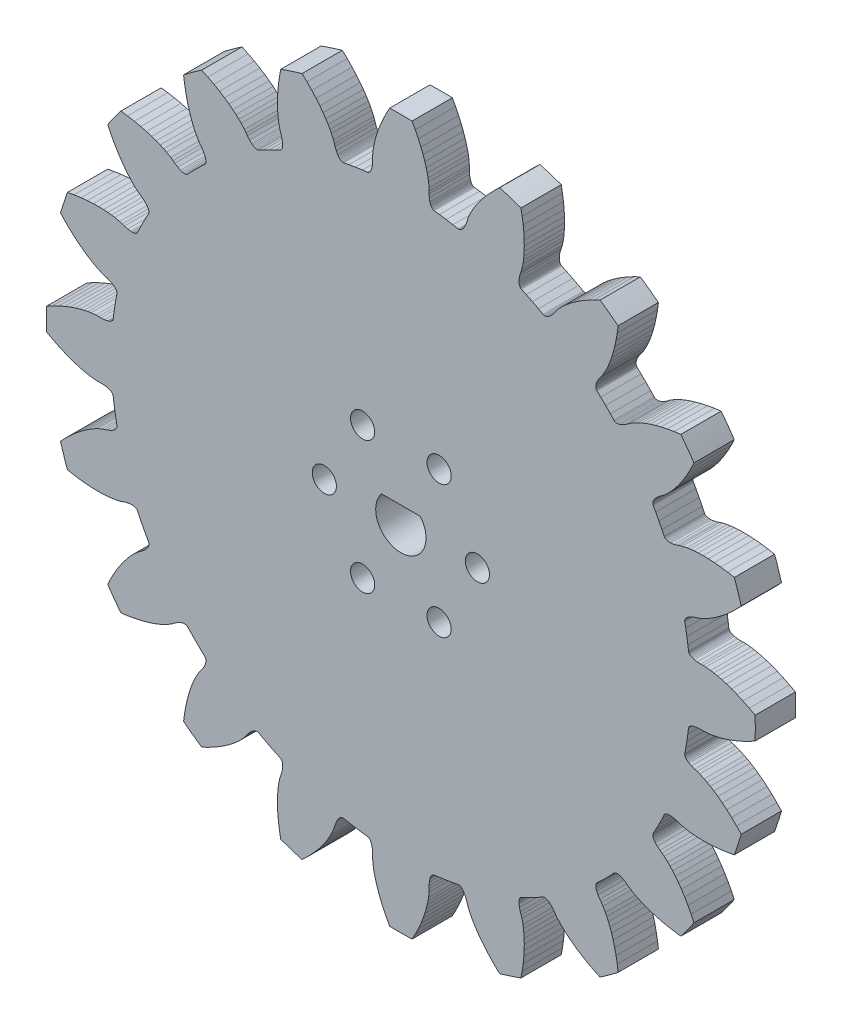
from build123d import *

# Parameters (mm, degrees)
MODEL_R             = 0.5
BOSS_EXTRUDE1_DEPTH = 5
CUT_EXTRUDE1_DEPTH  = 63.425869445
SKETCH6_R           = 1.5
CUT_EXTRUDE3_DEPTH  = 10
CIRPATTERN1_COUNT   = 3
SKETCH5_R           = 2.05
CUT_EXTRUDE2_DEPTH  = 10


with BuildPart() as part:
    # Model → Boss-Extrude1 (new body)
    with BuildSketch(Plane.XY):
        with BuildLine():
            Line((41.0580513, 11.0594647), (41.6786239, 11.6621942))
            Line((41.6786239, 11.6621942), (42.254799591, 12.268924064))
            ThreePointArc((42.254799591, 12.268924064), (41.846428175, 13.596728691), (41.396343585, 14.910979886))
            Line((41.396343585, 14.910979886), (40.5735808, 15.0631672))
            Line((40.5735808, 15.0631672), (39.7172515, 15.1860222))
            Line((39.7172515, 15.1860222), (38.9209581, 15.2664261))
            Line((38.9209581, 15.2664261), (38.188074, 15.3095207))
            Line((38.188074, 15.3095207), (37.5212498, 15.3207867))
            Line((37.5212498, 15.3207867), (36.9192091, 15.3057692))
            Line((36.9192091, 15.3057692), (36.385219, 15.2700607))
            Line((36.385219, 15.2700607), (35.9182805, 15.2191681))
            Line((35.9182805, 15.2191681), (35.519022, 15.1586865))
            Line((35.519022, 15.1586865), (34.9229912, 15.031255))
            Line((34.9229912, 15.031255), (34.5912709, 14.9315723))
            Line((34.5912709, 14.9315723), (34.3145829, 14.8346777))
            Line((34.3145829, 14.8346777), (33.8996768, 14.7245961))
            Line((33.8996768, 14.7245961), (33.5375203, 14.6729516))
            Line((33.5375203, 14.6729516), (33.3775076, 14.6675821))
            Line((33.3775076, 14.6675821), (33.232174, 14.6750343))
            Line((33.232174, 14.6750343), (33.1019936, 14.6947079))
            Line((33.1019936, 14.6947079), (32.9874095, 14.7259534))
            Line((32.9874095, 14.7259534), (32.8888203, 14.7681208))
            Line((32.8888203, 14.7681208), (32.8066469, 14.8205604))
            Line((32.8066469, 14.8205604), (32.74127, 14.8825908))
            Line((32.74127, 14.8825908), (32.6837041, 14.9725741))
            Line((32.6837041, 14.9725741), (32.4071065, 15.5624769))
            Line((32.4071065, 15.5624769), (32.0316845, 16.3209585))
            Line((32.0316845, 16.3209585), (31.6387276, 17.0705055))
            Line((31.6387276, 17.0705055), (31.3240661, 17.6410139))
            Line((31.3240661, 17.6410139), (31.2851045, 17.7404764))
            Line((31.2851045, 17.7404764), (31.2733484, 17.829828))
            Line((31.2733484, 17.829828), (31.2792242, 17.927131))
            Line((31.2792242, 17.927131), (31.3030593, 18.0316767))
            Line((31.3030593, 18.0316767), (31.345132, 18.1427428))
            Line((31.345132, 18.1427428), (31.4057339, 18.2596248))
            Line((31.4057339, 18.2596248), (31.48513, 18.3815824))
            Line((31.48513, 18.3815824), (31.583527, 18.5078793))
            Line((31.583527, 18.5078793), (31.8381786, 18.7705142))
            Line((31.8381786, 18.7705142), (32.1711122, 19.0414759))
            Line((32.1711122, 19.0414759), (32.4121346, 19.208368))
            Line((32.4121346, 19.208368), (32.6877599, 19.4181434))
            Line((32.6877599, 19.4181434), (33.1411923, 19.8254401))
            Line((33.1411923, 19.8254401), (33.4248012, 20.1128967))
            Line((33.4248012, 20.1128967), (33.7404338, 20.460744))
            Line((33.7404338, 20.460744), (34.083194, 20.8717622))
            Line((34.083194, 20.8717622), (34.4492141, 21.3499962))
            Line((34.4492141, 21.3499962), (34.8320491, 21.8960904))
            Line((34.8320491, 21.8960904), (35.2279633, 22.5143365))
            Line((35.2279633, 22.5143365), (35.6309647, 23.2058115))
            Line((35.6309647, 23.2058115), (36.0349107, 23.9708089))
            Line((36.0349107, 23.9708089), (36.395396459, 24.725891411))
            ThreePointArc((36.395396459, 24.725891411), (35.596697995, 25.862514918), (34.762516187, 26.973358268))
            Line((34.762516187, 26.973358268), (33.9329938, 26.8638493))
            Line((33.9329938, 26.8638493), (33.0806119, 26.716071))
            Line((33.0806119, 26.716071), (32.2984457, 26.5464715))
            Line((32.2984457, 26.5464715), (31.5881145, 26.3609832))
            Line((31.5881145, 26.3609832), (30.9504457, 26.1656379))
            Line((30.9504457, 26.1656379), (30.3825116, 25.9653146))
            Line((30.3825116, 25.9653146), (29.8856913, 25.7663418))
            Line((29.8856913, 25.7663418), (29.4573331, 25.5736481))
            Line((29.4573331, 25.5736481), (29.0963056, 25.392749))
            Line((29.0963056, 25.392749), (28.5688252, 25.0873708))
            Line((28.5688252, 25.0873708), (28.284144, 24.8900597))
            Line((28.284144, 24.8900597), (28.0509402, 24.7124062))
            Line((28.0509402, 24.7124062), (27.6903581, 24.4794994))
            Line((27.6903581, 24.4794994), (27.3618858, 24.3184699))
            Line((27.3618858, 24.3184699), (27.211364, 24.2639166))
            Line((27.211364, 24.2639166), (27.0708407, 24.2260935))
            Line((27.0708407, 24.2260935), (26.9409522, 24.2045762))
            Line((26.9409522, 24.2045762), (26.8223209, 24.198884))
            Line((26.8223209, 24.198884), (26.7155266, 24.2085219))
            Line((26.7155266, 24.2085219), (26.6211702, 24.2330019))
            Line((26.6211702, 24.2330019), (26.5398247, 24.2717938))
            Line((26.5398247, 24.2717938), (26.45727, 24.3395841))
            Line((26.45727, 24.3395841), (26.01192, 24.8151417))
            Line((26.01192, 24.8151417), (25.4204888, 25.4204888))
            Line((25.4204888, 25.4204888), (24.8151417, 26.01192))
            Line((24.8151417, 26.01192), (24.3395841, 26.45727))
            Line((24.3395841, 26.45727), (24.2717938, 26.5398247))
            Line((24.2717938, 26.5398247), (24.2330019, 26.6211702))
            Line((24.2330019, 26.6211702), (24.2085219, 26.7155266))
            Line((24.2085219, 26.7155266), (24.198884, 26.8223209))
            Line((24.198884, 26.8223209), (24.2045762, 26.9409522))
            Line((24.2045762, 26.9409522), (24.2260935, 27.0708407))
            Line((24.2260935, 27.0708407), (24.2639166, 27.211364))
            Line((24.2639166, 27.211364), (24.3184699, 27.3618858))
            Line((24.3184699, 27.3618858), (24.4794994, 27.6903581))
            Line((24.4794994, 27.6903581), (24.7124062, 28.0509402))
            Line((24.7124062, 28.0509402), (24.8900597, 28.284144))
            Line((24.8900597, 28.284144), (25.0873708, 28.5688252))
            Line((25.0873708, 28.5688252), (25.392749, 29.0963056))
            Line((25.392749, 29.0963056), (25.5736481, 29.4573331))
            Line((25.5736481, 29.4573331), (25.7663418, 29.8856913))
            Line((25.7663418, 29.8856913), (25.9653146, 30.3825116))
            Line((25.9653146, 30.3825116), (26.1656379, 30.9504457))
            Line((26.1656379, 30.9504457), (26.3609832, 31.5881145))
            Line((26.3609832, 31.5881145), (26.5464715, 32.2984457))
            Line((26.5464715, 32.2984457), (26.716071, 33.0806119))
            Line((26.716071, 33.0806119), (26.8638493, 33.9329938))
            Line((26.8638493, 33.9329938), (26.973358307, 34.762516234))
            ThreePointArc((26.973358307, 34.762516234), (25.862514956, 35.59669804), (24.725891448, 36.395396503))
            Line((24.725891448, 36.395396503), (23.9708089, 36.0349107))
            Line((23.9708089, 36.0349107), (23.2058115, 35.6309647))
            Line((23.2058115, 35.6309647), (22.5143365, 35.2279633))
            Line((22.5143365, 35.2279633), (21.8960904, 34.8320491))
            Line((21.8960904, 34.8320491), (21.3499962, 34.4492141))
            Line((21.3499962, 34.4492141), (20.8717622, 34.083194))
            Line((20.8717622, 34.083194), (20.460744, 33.7404338))
            Line((20.460744, 33.7404338), (20.1128967, 33.4248012))
            Line((20.1128967, 33.4248012), (19.8254401, 33.1411923))
            Line((19.8254401, 33.1411923), (19.4181434, 32.6877599))
            Line((19.4181434, 32.6877599), (19.208368, 32.4121346))
            Line((19.208368, 32.4121346), (19.0414759, 32.1711122))
            Line((19.0414759, 32.1711122), (18.7705142, 31.8381786))
            Line((18.7705142, 31.8381786), (18.5078793, 31.583527))
            Line((18.5078793, 31.583527), (18.3815824, 31.48513))
            Line((18.3815824, 31.48513), (18.2596248, 31.4057339))
            Line((18.2596248, 31.4057339), (18.1427428, 31.345132))
            Line((18.1427428, 31.345132), (18.0316767, 31.3030593))
            Line((18.0316767, 31.3030593), (17.927131, 31.2792242))
            Line((17.927131, 31.2792242), (17.829828, 31.2733484))
            Line((17.829828, 31.2733484), (17.7404764, 31.2851045))
            Line((17.7404764, 31.2851045), (17.6410139, 31.3240661))
            Line((17.6410139, 31.3240661), (17.0705055, 31.6387276))
            Line((17.0705055, 31.6387276), (16.3209585, 32.0316845))
            Line((16.3209585, 32.0316845), (15.5624769, 32.4071065))
            Line((15.5624769, 32.4071065), (14.9725741, 32.6837041))
            Line((14.9725741, 32.6837041), (14.8825908, 32.74127))
            Line((14.8825908, 32.74127), (14.8205604, 32.8066469))
            Line((14.8205604, 32.8066469), (14.7681208, 32.8888203))
            Line((14.7681208, 32.8888203), (14.7259534, 32.9874095))
            Line((14.7259534, 32.9874095), (14.6947079, 33.1019936))
            Line((14.6947079, 33.1019936), (14.6750343, 33.232174))
            Line((14.6750343, 33.232174), (14.6675821, 33.3775076))
            Line((14.6675821, 33.3775076), (14.6729516, 33.5375203))
            Line((14.6729516, 33.5375203), (14.7245961, 33.8996768))
            Line((14.7245961, 33.8996768), (14.8346777, 34.3145829))
            Line((14.8346777, 34.3145829), (14.9315723, 34.5912709))
            Line((14.9315723, 34.5912709), (15.031255, 34.9229912))
            Line((15.031255, 34.9229912), (15.1586865, 35.519022))
            Line((15.1586865, 35.519022), (15.2191681, 35.9182805))
            Line((15.2191681, 35.9182805), (15.2700607, 36.385219))
            Line((15.2700607, 36.385219), (15.3057692, 36.9192091))
            Line((15.3057692, 36.9192091), (15.3207867, 37.5212498))
            Line((15.3207867, 37.5212498), (15.3095207, 38.188074))
            Line((15.3095207, 38.188074), (15.2664261, 38.9209581))
            Line((15.2664261, 38.9209581), (15.1860222, 39.7172515))
            Line((15.1860222, 39.7172515), (15.0631672, 40.5735808))
            Line((15.0631672, 40.5735808), (14.910979886, 41.396343585))
            ThreePointArc((14.910979886, 41.396343585), (13.596728691, 41.846428175), (12.268924064, 42.254799591))
            Line((12.268924064, 42.254799591), (11.6621942, 41.6786239))
            Line((11.6621942, 41.6786239), (11.0594647, 41.0580513))
            Line((11.0594647, 41.0580513), (10.5263671, 40.4610966))
            Line((10.5263671, 40.4610966), (10.0607243, 39.8935113))
            Line((10.0607243, 39.8935113), (9.6596604, 39.3606612))
            Line((9.6596604, 39.3606612), (9.3179393, 38.864773))
            Line((9.3179393, 38.864773), (9.0329565, 38.411777))
            Line((9.0329565, 38.411777), (8.7996699, 38.0041019))
            Line((8.7996699, 38.0041019), (8.6139223, 37.6455448))
            Line((8.6139223, 37.6455448), (8.3666785, 37.0884434))
            Line((8.3666785, 37.0884434), (8.2523431, 36.761484))
            Line((8.2523431, 36.761484), (8.1680994, 36.4806855))
            Line((8.1680994, 36.4806855), (8.0132816, 36.0803151))
            Line((8.0132816, 36.0803151), (7.8421926, 35.7569684))
            Line((7.8421926, 35.7569684), (7.7524835, 35.6243594))
            Line((7.7524835, 35.6243594), (7.6610297, 35.5111623))
            Line((7.6610297, 35.5111623), (7.5685952, 35.4174079))
            Line((7.5685952, 35.4174079), (7.4759663, 35.3430731))
            Line((7.4759663, 35.3430731), (7.3839029, 35.2880982))
            Line((7.3839029, 35.2880982), (7.293178, 35.2524417))
            Line((7.293178, 35.2524417), (7.2045667, 35.2360112))
            Line((7.2045667, 35.2360112), (7.0979324, 35.2423303))
            Line((7.0979324, 35.2423303), (6.458111, 35.3652943))
            Line((6.458111, 35.3652943), (5.623819, 35.5073958))
            Line((5.623819, 35.5073958), (4.7864484, 35.6300597))
            Line((4.7864484, 35.6300597), (4.1399441, 35.7108296))
            Line((4.1399441, 35.7108296), (4.0365761, 35.7377716))
            Line((4.0365761, 35.7377716), (3.9573791, 35.7807803))
            Line((3.9573791, 35.7807803), (3.8821131, 35.8427272))
            Line((3.8821131, 35.8427272), (3.8115438, 35.9234606))
            Line((3.8115438, 35.9234606), (3.7464191, 36.0227811))
            Line((3.7464191, 36.0227811), (3.6874804, 36.1405106))
            Line((3.6874804, 36.1405106), (3.6354825, 36.2764283))
            Line((3.6354825, 36.2764283), (3.5911425, 36.4302686))
            Line((3.5911425, 36.4302686), (3.5283469, 36.790659))
            Line((3.5283469, 36.790659), (3.5048276, 37.2192752))
            Line((3.5048276, 37.2192752), (3.5114786, 37.5123632))
            Line((3.5114786, 37.5123632), (3.5037752, 37.8586516))
            Line((3.5037752, 37.8586516), (3.4407861, 38.4648891))
            Line((3.4407861, 38.4648891), (3.37493, 38.8632963))
            Line((3.37493, 38.8632963), (3.2790398, 39.3231079))
            Line((3.2790398, 39.3231079), (3.1479885, 39.8419972))
            Line((3.1479885, 39.8419972), (2.9762302, 40.4192126))
            Line((2.9762302, 40.4192126), (2.7594555, 41.0499187))
            Line((2.7594555, 41.0499187), (2.4919965, 41.7336159))
            Line((2.4919965, 41.7336159), (2.1694597, 42.4660898))
            Line((2.1694597, 42.4660898), (1.7879973, 43.2425431))
            Line((1.7879973, 43.2425431), (1.389010873, 43.978008589))
            ThreePointArc((1.389010873, 43.978008589), (-7.7e-08, 43.9999385), (-1.389011027, 43.978008585))
            Line((-1.389011027, 43.978008585), (-1.7879973, 43.2425431))
            Line((-1.7879973, 43.2425431), (-2.1694597, 42.4660898))
            Line((-2.1694597, 42.4660898), (-2.4919965, 41.7336159))
            Line((-2.4919965, 41.7336159), (-2.7594555, 41.0499187))
            Line((-2.7594555, 41.0499187), (-2.9762302, 40.4192126))
            Line((-2.9762302, 40.4192126), (-3.1479885, 39.8419972))
            Line((-3.1479885, 39.8419972), (-3.2790398, 39.3231079))
            Line((-3.2790398, 39.3231079), (-3.37493, 38.8632963))
            Line((-3.37493, 38.8632963), (-3.4407861, 38.4648891))
            Line((-3.4407861, 38.4648891), (-3.5037752, 37.8586516))
            Line((-3.5037752, 37.8586516), (-3.5114786, 37.5123632))
            Line((-3.5114786, 37.5123632), (-3.5048276, 37.2192752))
            Line((-3.5048276, 37.2192752), (-3.5283469, 36.790659))
            Line((-3.5283469, 36.790659), (-3.5911425, 36.4302686))
            Line((-3.5911425, 36.4302686), (-3.6354825, 36.2764283))
            Line((-3.6354825, 36.2764283), (-3.6874804, 36.1405106))
            Line((-3.6874804, 36.1405106), (-3.7464191, 36.0227811))
            Line((-3.7464191, 36.0227811), (-3.8115438, 35.9234606))
            Line((-3.8115438, 35.9234606), (-3.8821131, 35.8427272))
            Line((-3.8821131, 35.8427272), (-3.9573791, 35.7807803))
            Line((-3.9573791, 35.7807803), (-4.0365761, 35.7377716))
            Line((-4.0365761, 35.7377716), (-4.1399441, 35.7108296))
            Line((-4.1399441, 35.7108296), (-4.7864484, 35.6300597))
            Line((-4.7864484, 35.6300597), (-5.623819, 35.5073958))
            Line((-5.623819, 35.5073958), (-6.458111, 35.3652943))
            Line((-6.458111, 35.3652943), (-7.0979324, 35.2423303))
            Line((-7.0979324, 35.2423303), (-7.2045667, 35.2360112))
            Line((-7.2045667, 35.2360112), (-7.293178, 35.2524417))
            Line((-7.293178, 35.2524417), (-7.3839029, 35.2880982))
            Line((-7.3839029, 35.2880982), (-7.4759663, 35.3430731))
            Line((-7.4759663, 35.3430731), (-7.5685952, 35.4174079))
            Line((-7.5685952, 35.4174079), (-7.6610297, 35.5111623))
            Line((-7.6610297, 35.5111623), (-7.7524835, 35.6243594))
            Line((-7.7524835, 35.6243594), (-7.8421926, 35.7569684))
            Line((-7.8421926, 35.7569684), (-8.0132816, 36.0803151))
            Line((-8.0132816, 36.0803151), (-8.1680994, 36.4806855))
            Line((-8.1680994, 36.4806855), (-8.2523431, 36.761484))
            Line((-8.2523431, 36.761484), (-8.3666785, 37.0884434))
            Line((-8.3666785, 37.0884434), (-8.6139223, 37.6455448))
            Line((-8.6139223, 37.6455448), (-8.7996699, 38.0041019))
            Line((-8.7996699, 38.0041019), (-9.0329565, 38.411777))
            Line((-9.0329565, 38.411777), (-9.3179393, 38.864773))
            Line((-9.3179393, 38.864773), (-9.6596604, 39.3606612))
            Line((-9.6596604, 39.3606612), (-10.0607243, 39.8935113))
            Line((-10.0607243, 39.8935113), (-10.5263671, 40.4610966))
            Line((-10.5263671, 40.4610966), (-11.0594647, 41.0580513))
            Line((-11.0594647, 41.0580513), (-11.6621942, 41.6786239))
            Line((-11.6621942, 41.6786239), (-12.268924064, 42.254799591))
            ThreePointArc((-12.268924064, 42.254799591), (-13.596728691, 41.846428175), (-14.910979886, 41.396343585))
            Line((-14.910979886, 41.396343585), (-15.0631672, 40.5735808))
            Line((-15.0631672, 40.5735808), (-15.1860222, 39.7172515))
            Line((-15.1860222, 39.7172515), (-15.2664261, 38.9209581))
            Line((-15.2664261, 38.9209581), (-15.3095207, 38.188074))
            Line((-15.3095207, 38.188074), (-15.3207867, 37.5212498))
            Line((-15.3207867, 37.5212498), (-15.3057692, 36.9192091))
            Line((-15.3057692, 36.9192091), (-15.2700607, 36.385219))
            Line((-15.2700607, 36.385219), (-15.2191681, 35.9182805))
            Line((-15.2191681, 35.9182805), (-15.1586865, 35.519022))
            Line((-15.1586865, 35.519022), (-15.031255, 34.9229912))
            Line((-15.031255, 34.9229912), (-14.9315723, 34.5912709))
            Line((-14.9315723, 34.5912709), (-14.8346777, 34.3145829))
            Line((-14.8346777, 34.3145829), (-14.7245961, 33.8996768))
            Line((-14.7245961, 33.8996768), (-14.6729516, 33.5375203))
            Line((-14.6729516, 33.5375203), (-14.6675821, 33.3775076))
            Line((-14.6675821, 33.3775076), (-14.6750343, 33.232174))
            Line((-14.6750343, 33.232174), (-14.6947079, 33.1019936))
            Line((-14.6947079, 33.1019936), (-14.7259534, 32.9874095))
            Line((-14.7259534, 32.9874095), (-14.7681208, 32.8888203))
            Line((-14.7681208, 32.8888203), (-14.8205604, 32.8066469))
            Line((-14.8205604, 32.8066469), (-14.8825908, 32.74127))
            Line((-14.8825908, 32.74127), (-14.9725741, 32.6837041))
            Line((-14.9725741, 32.6837041), (-15.5624769, 32.4071065))
            Line((-15.5624769, 32.4071065), (-16.3209585, 32.0316845))
            Line((-16.3209585, 32.0316845), (-17.0705055, 31.6387276))
            Line((-17.0705055, 31.6387276), (-17.6410139, 31.3240661))
            Line((-17.6410139, 31.3240661), (-17.7404764, 31.2851045))
            Line((-17.7404764, 31.2851045), (-17.829828, 31.2733484))
            Line((-17.829828, 31.2733484), (-17.927131, 31.2792242))
            Line((-17.927131, 31.2792242), (-18.0316767, 31.3030593))
            Line((-18.0316767, 31.3030593), (-18.1427428, 31.345132))
            Line((-18.1427428, 31.345132), (-18.2596248, 31.4057339))
            Line((-18.2596248, 31.4057339), (-18.3815824, 31.48513))
            Line((-18.3815824, 31.48513), (-18.5078793, 31.583527))
            Line((-18.5078793, 31.583527), (-18.7705142, 31.8381786))
            Line((-18.7705142, 31.8381786), (-19.0414759, 32.1711122))
            Line((-19.0414759, 32.1711122), (-19.208368, 32.4121346))
            Line((-19.208368, 32.4121346), (-19.4181434, 32.6877599))
            Line((-19.4181434, 32.6877599), (-19.8254401, 33.1411923))
            Line((-19.8254401, 33.1411923), (-20.1128967, 33.4248012))
            Line((-20.1128967, 33.4248012), (-20.460744, 33.7404338))
            Line((-20.460744, 33.7404338), (-20.8717622, 34.083194))
            Line((-20.8717622, 34.083194), (-21.3499962, 34.4492141))
            Line((-21.3499962, 34.4492141), (-21.8960904, 34.8320491))
            Line((-21.8960904, 34.8320491), (-22.5143365, 35.2279633))
            Line((-22.5143365, 35.2279633), (-23.2058115, 35.6309647))
            Line((-23.2058115, 35.6309647), (-23.9708089, 36.0349107))
            Line((-23.9708089, 36.0349107), (-24.725891411, 36.395396459))
            ThreePointArc((-24.725891411, 36.395396459), (-25.862514918, 35.596697995), (-26.973358268, 34.762516187))
            Line((-26.973358268, 34.762516187), (-26.8638493, 33.9329938))
            Line((-26.8638493, 33.9329938), (-26.716071, 33.0806119))
            Line((-26.716071, 33.0806119), (-26.5464715, 32.2984457))
            Line((-26.5464715, 32.2984457), (-26.3609832, 31.5881145))
            Line((-26.3609832, 31.5881145), (-26.1656379, 30.9504457))
            Line((-26.1656379, 30.9504457), (-25.9653146, 30.3825116))
            Line((-25.9653146, 30.3825116), (-25.7663418, 29.8856913))
            Line((-25.7663418, 29.8856913), (-25.5736481, 29.4573331))
            Line((-25.5736481, 29.4573331), (-25.392749, 29.0963056))
            Line((-25.392749, 29.0963056), (-25.0873708, 28.5688252))
            Line((-25.0873708, 28.5688252), (-24.8900597, 28.284144))
            Line((-24.8900597, 28.284144), (-24.7124062, 28.0509402))
            Line((-24.7124062, 28.0509402), (-24.4794994, 27.6903581))
            Line((-24.4794994, 27.6903581), (-24.3184699, 27.3618858))
            Line((-24.3184699, 27.3618858), (-24.2639166, 27.211364))
            Line((-24.2639166, 27.211364), (-24.2260935, 27.0708407))
            Line((-24.2260935, 27.0708407), (-24.2045762, 26.9409522))
            Line((-24.2045762, 26.9409522), (-24.198884, 26.8223209))
            Line((-24.198884, 26.8223209), (-24.2085219, 26.7155266))
            Line((-24.2085219, 26.7155266), (-24.2330019, 26.6211702))
            Line((-24.2330019, 26.6211702), (-24.2717938, 26.5398247))
            Line((-24.2717938, 26.5398247), (-24.3395841, 26.45727))
            Line((-24.3395841, 26.45727), (-24.8151417, 26.01192))
            Line((-24.8151417, 26.01192), (-25.4204888, 25.4204888))
            Line((-25.4204888, 25.4204888), (-26.01192, 24.8151417))
            Line((-26.01192, 24.8151417), (-26.45727, 24.3395841))
            Line((-26.45727, 24.3395841), (-26.5398247, 24.2717938))
            Line((-26.5398247, 24.2717938), (-26.6211702, 24.2330019))
            Line((-26.6211702, 24.2330019), (-26.7155266, 24.2085219))
            Line((-26.7155266, 24.2085219), (-26.8223209, 24.198884))
            Line((-26.8223209, 24.198884), (-26.9409522, 24.2045762))
            Line((-26.9409522, 24.2045762), (-27.0708407, 24.2260935))
            Line((-27.0708407, 24.2260935), (-27.211364, 24.2639166))
            Line((-27.211364, 24.2639166), (-27.3618858, 24.3184699))
            Line((-27.3618858, 24.3184699), (-27.6903581, 24.4794994))
            Line((-27.6903581, 24.4794994), (-28.0509402, 24.7124062))
            Line((-28.0509402, 24.7124062), (-28.284144, 24.8900597))
            Line((-28.284144, 24.8900597), (-28.5688252, 25.0873708))
            Line((-28.5688252, 25.0873708), (-29.0963056, 25.392749))
            Line((-29.0963056, 25.392749), (-29.4573331, 25.5736481))
            Line((-29.4573331, 25.5736481), (-29.8856913, 25.7663418))
            Line((-29.8856913, 25.7663418), (-30.3825116, 25.9653146))
            Line((-30.3825116, 25.9653146), (-30.9504457, 26.1656379))
            Line((-30.9504457, 26.1656379), (-31.5881145, 26.3609832))
            Line((-31.5881145, 26.3609832), (-32.2984457, 26.5464715))
            Line((-32.2984457, 26.5464715), (-33.0806119, 26.716071))
            Line((-33.0806119, 26.716071), (-33.9329938, 26.8638493))
            Line((-33.9329938, 26.8638493), (-34.762516234, 26.973358307))
            ThreePointArc((-34.762516234, 26.973358307), (-35.59669804, 25.862514956), (-36.395396503, 24.725891448))
            Line((-36.395396503, 24.725891448), (-36.0349107, 23.9708089))
            Line((-36.0349107, 23.9708089), (-35.6309647, 23.2058115))
            Line((-35.6309647, 23.2058115), (-35.2279633, 22.5143365))
            Line((-35.2279633, 22.5143365), (-34.8320491, 21.8960904))
            Line((-34.8320491, 21.8960904), (-34.4492141, 21.3499962))
            Line((-34.4492141, 21.3499962), (-34.083194, 20.8717622))
            Line((-34.083194, 20.8717622), (-33.7404338, 20.460744))
            Line((-33.7404338, 20.460744), (-33.4248012, 20.1128967))
            Line((-33.4248012, 20.1128967), (-33.1411923, 19.8254401))
            Line((-33.1411923, 19.8254401), (-32.6877599, 19.4181434))
            Line((-32.6877599, 19.4181434), (-32.4121346, 19.208368))
            Line((-32.4121346, 19.208368), (-32.1711122, 19.0414759))
            Line((-32.1711122, 19.0414759), (-31.8381786, 18.7705142))
            Line((-31.8381786, 18.7705142), (-31.583527, 18.5078793))
            Line((-31.583527, 18.5078793), (-31.48513, 18.3815824))
            Line((-31.48513, 18.3815824), (-31.4057339, 18.2596248))
            Line((-31.4057339, 18.2596248), (-31.345132, 18.1427428))
            Line((-31.345132, 18.1427428), (-31.3030593, 18.0316767))
            Line((-31.3030593, 18.0316767), (-31.2792242, 17.927131))
            Line((-31.2792242, 17.927131), (-31.2733484, 17.829828))
            Line((-31.2733484, 17.829828), (-31.2851045, 17.7404764))
            Line((-31.2851045, 17.7404764), (-31.3240661, 17.6410139))
            Line((-31.3240661, 17.6410139), (-31.6387276, 17.0705055))
            Line((-31.6387276, 17.0705055), (-32.0316845, 16.3209585))
            Line((-32.0316845, 16.3209585), (-32.4071065, 15.5624769))
            Line((-32.4071065, 15.5624769), (-32.6837041, 14.9725741))
            Line((-32.6837041, 14.9725741), (-32.74127, 14.8825908))
            Line((-32.74127, 14.8825908), (-32.8066469, 14.8205604))
            Line((-32.8066469, 14.8205604), (-32.8888203, 14.7681208))
            Line((-32.8888203, 14.7681208), (-32.9874095, 14.7259534))
            Line((-32.9874095, 14.7259534), (-33.1019936, 14.6947079))
            Line((-33.1019936, 14.6947079), (-33.232174, 14.6750343))
            Line((-33.232174, 14.6750343), (-33.3775076, 14.6675821))
            Line((-33.3775076, 14.6675821), (-33.5375203, 14.6729516))
            Line((-33.5375203, 14.6729516), (-33.8996768, 14.7245961))
            Line((-33.8996768, 14.7245961), (-34.3145829, 14.8346777))
            Line((-34.3145829, 14.8346777), (-34.5912709, 14.9315723))
            Line((-34.5912709, 14.9315723), (-34.9229912, 15.031255))
            Line((-34.9229912, 15.031255), (-35.519022, 15.1586865))
            Line((-35.519022, 15.1586865), (-35.9182805, 15.2191681))
            Line((-35.9182805, 15.2191681), (-36.385219, 15.2700607))
            Line((-36.385219, 15.2700607), (-36.9192091, 15.3057692))
            Line((-36.9192091, 15.3057692), (-37.5212498, 15.3207867))
            Line((-37.5212498, 15.3207867), (-38.188074, 15.3095207))
            Line((-38.188074, 15.3095207), (-38.9209581, 15.2664261))
            Line((-38.9209581, 15.2664261), (-39.7172515, 15.1860222))
            Line((-39.7172515, 15.1860222), (-40.5735808, 15.0631672))
            Line((-40.5735808, 15.0631672), (-41.396343585, 14.910979886))
            ThreePointArc((-41.396343585, 14.910979886), (-41.846428175, 13.596728691), (-42.254799591, 12.268924064))
            Line((-42.254799591, 12.268924064), (-41.6786239, 11.6621942))
            Line((-41.6786239, 11.6621942), (-41.0580513, 11.0594647))
            Line((-41.0580513, 11.0594647), (-40.4610966, 10.5263671))
            Line((-40.4610966, 10.5263671), (-39.8935113, 10.0607243))
            Line((-39.8935113, 10.0607243), (-39.3606612, 9.6596604))
            Line((-39.3606612, 9.6596604), (-38.864773, 9.3179393))
            Line((-38.864773, 9.3179393), (-38.411777, 9.0329565))
            Line((-38.411777, 9.0329565), (-38.0041019, 8.7996699))
            Line((-38.0041019, 8.7996699), (-37.6455448, 8.6139223))
            Line((-37.6455448, 8.6139223), (-37.0884434, 8.3666785))
            Line((-37.0884434, 8.3666785), (-36.761484, 8.2523431))
            Line((-36.761484, 8.2523431), (-36.4806855, 8.1680994))
            Line((-36.4806855, 8.1680994), (-36.0803151, 8.0132816))
            Line((-36.0803151, 8.0132816), (-35.7569684, 7.8421926))
            Line((-35.7569684, 7.8421926), (-35.6243594, 7.7524835))
            Line((-35.6243594, 7.7524835), (-35.5111623, 7.6610297))
            Line((-35.5111623, 7.6610297), (-35.4174079, 7.5685952))
            Line((-35.4174079, 7.5685952), (-35.3430731, 7.4759663))
            Line((-35.3430731, 7.4759663), (-35.2880982, 7.3839029))
            Line((-35.2880982, 7.3839029), (-35.2524417, 7.293178))
            Line((-35.2524417, 7.293178), (-35.2360112, 7.2045667))
            Line((-35.2360112, 7.2045667), (-35.2423303, 7.0979324))
            Line((-35.2423303, 7.0979324), (-35.3652943, 6.458111))
            Line((-35.3652943, 6.458111), (-35.5073958, 5.623819))
            Line((-35.5073958, 5.623819), (-35.6300597, 4.7864484))
            Line((-35.6300597, 4.7864484), (-35.7108296, 4.1399441))
            Line((-35.7108296, 4.1399441), (-35.7377716, 4.0365761))
            Line((-35.7377716, 4.0365761), (-35.7807803, 3.9573791))
            Line((-35.7807803, 3.9573791), (-35.8427272, 3.8821131))
            Line((-35.8427272, 3.8821131), (-35.9234606, 3.8115438))
            Line((-35.9234606, 3.8115438), (-36.0227811, 3.7464191))
            Line((-36.0227811, 3.7464191), (-36.1405106, 3.6874804))
            Line((-36.1405106, 3.6874804), (-36.2764283, 3.6354825))
            Line((-36.2764283, 3.6354825), (-36.4302686, 3.5911425))
            Line((-36.4302686, 3.5911425), (-36.790659, 3.5283469))
            Line((-36.790659, 3.5283469), (-37.2192752, 3.5048276))
            Line((-37.2192752, 3.5048276), (-37.5123632, 3.5114786))
            Line((-37.5123632, 3.5114786), (-37.8586516, 3.5037752))
            Line((-37.8586516, 3.5037752), (-38.4648891, 3.4407861))
            Line((-38.4648891, 3.4407861), (-38.8632963, 3.37493))
            Line((-38.8632963, 3.37493), (-39.3231079, 3.2790398))
            Line((-39.3231079, 3.2790398), (-39.8419972, 3.1479885))
            Line((-39.8419972, 3.1479885), (-40.4192126, 2.9762302))
            Line((-40.4192126, 2.9762302), (-41.0499187, 2.7594555))
            Line((-41.0499187, 2.7594555), (-41.7336159, 2.4919965))
            Line((-41.7336159, 2.4919965), (-42.4660898, 2.1694597))
            Line((-42.4660898, 2.1694597), (-43.2425431, 1.7879973))
            Line((-43.2425431, 1.7879973), (-43.978008589, 1.389010873))
            ThreePointArc((-43.978008589, 1.389010873), (-43.9999385, -7.7e-08), (-43.978008585, -1.389011027))
            Line((-43.978008585, -1.389011027), (-43.2425431, -1.7879973))
            Line((-43.2425431, -1.7879973), (-42.4660898, -2.1694597))
            Line((-42.4660898, -2.1694597), (-41.7336159, -2.4919965))
            Line((-41.7336159, -2.4919965), (-41.0499187, -2.7594555))
            Line((-41.0499187, -2.7594555), (-40.4192126, -2.9762302))
            Line((-40.4192126, -2.9762302), (-39.8419972, -3.1479885))
            Line((-39.8419972, -3.1479885), (-39.3231079, -3.2790398))
            Line((-39.3231079, -3.2790398), (-38.8632963, -3.37493))
            Line((-38.8632963, -3.37493), (-38.4648891, -3.4407861))
            Line((-38.4648891, -3.4407861), (-37.8586516, -3.5037752))
            Line((-37.8586516, -3.5037752), (-37.5123632, -3.5114786))
            Line((-37.5123632, -3.5114786), (-37.2192752, -3.5048276))
            Line((-37.2192752, -3.5048276), (-36.790659, -3.5283469))
            Line((-36.790659, -3.5283469), (-36.4302686, -3.5911425))
            Line((-36.4302686, -3.5911425), (-36.2764283, -3.6354825))
            Line((-36.2764283, -3.6354825), (-36.1405106, -3.6874804))
            Line((-36.1405106, -3.6874804), (-36.0227811, -3.7464191))
            Line((-36.0227811, -3.7464191), (-35.9234606, -3.8115438))
            Line((-35.9234606, -3.8115438), (-35.8427272, -3.8821131))
            Line((-35.8427272, -3.8821131), (-35.7807803, -3.9573791))
            Line((-35.7807803, -3.9573791), (-35.7377716, -4.0365761))
            Line((-35.7377716, -4.0365761), (-35.7108296, -4.1399441))
            Line((-35.7108296, -4.1399441), (-35.6300597, -4.7864484))
            Line((-35.6300597, -4.7864484), (-35.5073958, -5.623819))
            Line((-35.5073958, -5.623819), (-35.3652943, -6.458111))
            Line((-35.3652943, -6.458111), (-35.2423303, -7.0979324))
            Line((-35.2423303, -7.0979324), (-35.2360112, -7.2045667))
            Line((-35.2360112, -7.2045667), (-35.2524417, -7.293178))
            Line((-35.2524417, -7.293178), (-35.2880982, -7.3839029))
            Line((-35.2880982, -7.3839029), (-35.3430731, -7.4759663))
            Line((-35.3430731, -7.4759663), (-35.4174079, -7.5685952))
            Line((-35.4174079, -7.5685952), (-35.5111623, -7.6610297))
            Line((-35.5111623, -7.6610297), (-35.6243594, -7.7524835))
            Line((-35.6243594, -7.7524835), (-35.7569684, -7.8421926))
            Line((-35.7569684, -7.8421926), (-36.0803151, -8.0132816))
            Line((-36.0803151, -8.0132816), (-36.4806855, -8.1680994))
            Line((-36.4806855, -8.1680994), (-36.761484, -8.2523431))
            Line((-36.761484, -8.2523431), (-37.0884434, -8.3666785))
            Line((-37.0884434, -8.3666785), (-37.6455448, -8.6139223))
            Line((-37.6455448, -8.6139223), (-38.0041019, -8.7996699))
            Line((-38.0041019, -8.7996699), (-38.411777, -9.0329565))
            Line((-38.411777, -9.0329565), (-38.864773, -9.3179393))
            Line((-38.864773, -9.3179393), (-39.3606612, -9.6596604))
            Line((-39.3606612, -9.6596604), (-39.8935113, -10.0607243))
            Line((-39.8935113, -10.0607243), (-40.4610966, -10.5263671))
            Line((-40.4610966, -10.5263671), (-41.0580513, -11.0594647))
            Line((-41.0580513, -11.0594647), (-41.6786239, -11.6621942))
            Line((-41.6786239, -11.6621942), (-42.254799591, -12.268924064))
            ThreePointArc((-42.254799591, -12.268924064), (-41.846428175, -13.596728691), (-41.396343585, -14.910979886))
            Line((-41.396343585, -14.910979886), (-40.5735808, -15.0631672))
            Line((-40.5735808, -15.0631672), (-39.7172515, -15.1860222))
            Line((-39.7172515, -15.1860222), (-38.9209581, -15.2664261))
            Line((-38.9209581, -15.2664261), (-38.188074, -15.3095207))
            Line((-38.188074, -15.3095207), (-37.5212498, -15.3207867))
            Line((-37.5212498, -15.3207867), (-36.9192091, -15.3057692))
            Line((-36.9192091, -15.3057692), (-36.385219, -15.2700607))
            Line((-36.385219, -15.2700607), (-35.9182805, -15.2191681))
            Line((-35.9182805, -15.2191681), (-35.519022, -15.1586865))
            Line((-35.519022, -15.1586865), (-34.9229912, -15.031255))
            Line((-34.9229912, -15.031255), (-34.5912709, -14.9315723))
            Line((-34.5912709, -14.9315723), (-34.3145829, -14.8346777))
            Line((-34.3145829, -14.8346777), (-33.8996768, -14.7245961))
            Line((-33.8996768, -14.7245961), (-33.5375203, -14.6729516))
            Line((-33.5375203, -14.6729516), (-33.3775076, -14.6675821))
            Line((-33.3775076, -14.6675821), (-33.232174, -14.6750343))
            Line((-33.232174, -14.6750343), (-33.1019936, -14.6947079))
            Line((-33.1019936, -14.6947079), (-32.9874095, -14.7259534))
            Line((-32.9874095, -14.7259534), (-32.8888203, -14.7681208))
            Line((-32.8888203, -14.7681208), (-32.8066469, -14.8205604))
            Line((-32.8066469, -14.8205604), (-32.74127, -14.8825908))
            Line((-32.74127, -14.8825908), (-32.6837041, -14.9725741))
            Line((-32.6837041, -14.9725741), (-32.4071065, -15.5624769))
            Line((-32.4071065, -15.5624769), (-32.0316845, -16.3209585))
            Line((-32.0316845, -16.3209585), (-31.6387276, -17.0705055))
            Line((-31.6387276, -17.0705055), (-31.3240661, -17.6410139))
            Line((-31.3240661, -17.6410139), (-31.2851045, -17.7404764))
            Line((-31.2851045, -17.7404764), (-31.2733484, -17.829828))
            Line((-31.2733484, -17.829828), (-31.2792242, -17.927131))
            Line((-31.2792242, -17.927131), (-31.3030593, -18.0316767))
            Line((-31.3030593, -18.0316767), (-31.345132, -18.1427428))
            Line((-31.345132, -18.1427428), (-31.4057339, -18.2596248))
            Line((-31.4057339, -18.2596248), (-31.48513, -18.3815824))
            Line((-31.48513, -18.3815824), (-31.583527, -18.5078793))
            Line((-31.583527, -18.5078793), (-31.8381786, -18.7705142))
            Line((-31.8381786, -18.7705142), (-32.1711122, -19.0414759))
            Line((-32.1711122, -19.0414759), (-32.4121346, -19.208368))
            Line((-32.4121346, -19.208368), (-32.6877599, -19.4181434))
            Line((-32.6877599, -19.4181434), (-33.1411923, -19.8254401))
            Line((-33.1411923, -19.8254401), (-33.4248012, -20.1128967))
            Line((-33.4248012, -20.1128967), (-33.7404338, -20.460744))
            Line((-33.7404338, -20.460744), (-34.083194, -20.8717622))
            Line((-34.083194, -20.8717622), (-34.4492141, -21.3499962))
            Line((-34.4492141, -21.3499962), (-34.8320491, -21.8960904))
            Line((-34.8320491, -21.8960904), (-35.2279633, -22.5143365))
            Line((-35.2279633, -22.5143365), (-35.6309647, -23.2058115))
            Line((-35.6309647, -23.2058115), (-36.0349107, -23.9708089))
            Line((-36.0349107, -23.9708089), (-36.395396459, -24.725891411))
            ThreePointArc((-36.395396459, -24.725891411), (-35.596697995, -25.862514918), (-34.762516187, -26.973358268))
            Line((-34.762516187, -26.973358268), (-33.9329938, -26.8638493))
            Line((-33.9329938, -26.8638493), (-33.0806119, -26.716071))
            Line((-33.0806119, -26.716071), (-32.2984457, -26.5464715))
            Line((-32.2984457, -26.5464715), (-31.5881145, -26.3609832))
            Line((-31.5881145, -26.3609832), (-30.9504457, -26.1656379))
            Line((-30.9504457, -26.1656379), (-30.3825116, -25.9653146))
            Line((-30.3825116, -25.9653146), (-29.8856913, -25.7663418))
            Line((-29.8856913, -25.7663418), (-29.4573331, -25.5736481))
            Line((-29.4573331, -25.5736481), (-29.0963056, -25.392749))
            Line((-29.0963056, -25.392749), (-28.5688252, -25.0873708))
            Line((-28.5688252, -25.0873708), (-28.284144, -24.8900597))
            Line((-28.284144, -24.8900597), (-28.0509402, -24.7124062))
            Line((-28.0509402, -24.7124062), (-27.6903581, -24.4794994))
            Line((-27.6903581, -24.4794994), (-27.3618858, -24.3184699))
            Line((-27.3618858, -24.3184699), (-27.211364, -24.2639166))
            Line((-27.211364, -24.2639166), (-27.0708407, -24.2260935))
            Line((-27.0708407, -24.2260935), (-26.9409522, -24.2045762))
            Line((-26.9409522, -24.2045762), (-26.8223209, -24.198884))
            Line((-26.8223209, -24.198884), (-26.7155266, -24.2085219))
            Line((-26.7155266, -24.2085219), (-26.6211702, -24.2330019))
            Line((-26.6211702, -24.2330019), (-26.5398247, -24.2717938))
            Line((-26.5398247, -24.2717938), (-26.45727, -24.3395841))
            Line((-26.45727, -24.3395841), (-26.01192, -24.8151417))
            Line((-26.01192, -24.8151417), (-25.4204888, -25.4204888))
            Line((-25.4204888, -25.4204888), (-24.8151417, -26.01192))
            Line((-24.8151417, -26.01192), (-24.3395841, -26.45727))
            Line((-24.3395841, -26.45727), (-24.2717938, -26.5398247))
            Line((-24.2717938, -26.5398247), (-24.2330019, -26.6211702))
            Line((-24.2330019, -26.6211702), (-24.2085219, -26.7155266))
            Line((-24.2085219, -26.7155266), (-24.198884, -26.8223209))
            Line((-24.198884, -26.8223209), (-24.2045762, -26.9409522))
            Line((-24.2045762, -26.9409522), (-24.2260935, -27.0708407))
            Line((-24.2260935, -27.0708407), (-24.2639166, -27.211364))
            Line((-24.2639166, -27.211364), (-24.3184699, -27.3618858))
            Line((-24.3184699, -27.3618858), (-24.4794994, -27.6903581))
            Line((-24.4794994, -27.6903581), (-24.7124062, -28.0509402))
            Line((-24.7124062, -28.0509402), (-24.8900597, -28.284144))
            Line((-24.8900597, -28.284144), (-25.0873708, -28.5688252))
            Line((-25.0873708, -28.5688252), (-25.392749, -29.0963056))
            Line((-25.392749, -29.0963056), (-25.5736481, -29.4573331))
            Line((-25.5736481, -29.4573331), (-25.7663418, -29.8856913))
            Line((-25.7663418, -29.8856913), (-25.9653146, -30.3825116))
            Line((-25.9653146, -30.3825116), (-26.1656379, -30.9504457))
            Line((-26.1656379, -30.9504457), (-26.3609832, -31.5881145))
            Line((-26.3609832, -31.5881145), (-26.5464715, -32.2984457))
            Line((-26.5464715, -32.2984457), (-26.716071, -33.0806119))
            Line((-26.716071, -33.0806119), (-26.8638493, -33.9329938))
            Line((-26.8638493, -33.9329938), (-26.973358307, -34.762516234))
            ThreePointArc((-26.973358307, -34.762516234), (-25.862514956, -35.59669804), (-24.725891448, -36.395396503))
            Line((-24.725891448, -36.395396503), (-23.9708089, -36.0349107))
            Line((-23.9708089, -36.0349107), (-23.2058115, -35.6309647))
            Line((-23.2058115, -35.6309647), (-22.5143365, -35.2279633))
            Line((-22.5143365, -35.2279633), (-21.8960904, -34.8320491))
            Line((-21.8960904, -34.8320491), (-21.3499962, -34.4492141))
            Line((-21.3499962, -34.4492141), (-20.8717622, -34.083194))
            Line((-20.8717622, -34.083194), (-20.460744, -33.7404338))
            Line((-20.460744, -33.7404338), (-20.1128967, -33.4248012))
            Line((-20.1128967, -33.4248012), (-19.8254401, -33.1411923))
            Line((-19.8254401, -33.1411923), (-19.4181434, -32.6877599))
            Line((-19.4181434, -32.6877599), (-19.208368, -32.4121346))
            Line((-19.208368, -32.4121346), (-19.0414759, -32.1711122))
            Line((-19.0414759, -32.1711122), (-18.7705142, -31.8381786))
            Line((-18.7705142, -31.8381786), (-18.5078793, -31.583527))
            Line((-18.5078793, -31.583527), (-18.3815824, -31.48513))
            Line((-18.3815824, -31.48513), (-18.2596248, -31.4057339))
            Line((-18.2596248, -31.4057339), (-18.1427428, -31.345132))
            Line((-18.1427428, -31.345132), (-18.0316767, -31.3030593))
            Line((-18.0316767, -31.3030593), (-17.927131, -31.2792242))
            Line((-17.927131, -31.2792242), (-17.829828, -31.2733484))
            Line((-17.829828, -31.2733484), (-17.7404764, -31.2851045))
            Line((-17.7404764, -31.2851045), (-17.6410139, -31.3240661))
            Line((-17.6410139, -31.3240661), (-17.0705055, -31.6387276))
            Line((-17.0705055, -31.6387276), (-16.3209585, -32.0316845))
            Line((-16.3209585, -32.0316845), (-15.5624769, -32.4071065))
            Line((-15.5624769, -32.4071065), (-14.9725741, -32.6837041))
            Line((-14.9725741, -32.6837041), (-14.8825908, -32.74127))
            Line((-14.8825908, -32.74127), (-14.8205604, -32.8066469))
            Line((-14.8205604, -32.8066469), (-14.7681208, -32.8888203))
            Line((-14.7681208, -32.8888203), (-14.7259534, -32.9874095))
            Line((-14.7259534, -32.9874095), (-14.6947079, -33.1019936))
            Line((-14.6947079, -33.1019936), (-14.6750343, -33.232174))
            Line((-14.6750343, -33.232174), (-14.6675821, -33.3775076))
            Line((-14.6675821, -33.3775076), (-14.6729516, -33.5375203))
            Line((-14.6729516, -33.5375203), (-14.7245961, -33.8996768))
            Line((-14.7245961, -33.8996768), (-14.8346777, -34.3145829))
            Line((-14.8346777, -34.3145829), (-14.9315723, -34.5912709))
            Line((-14.9315723, -34.5912709), (-15.031255, -34.9229912))
            Line((-15.031255, -34.9229912), (-15.1586865, -35.519022))
            Line((-15.1586865, -35.519022), (-15.2191681, -35.9182805))
            Line((-15.2191681, -35.9182805), (-15.2700607, -36.385219))
            Line((-15.2700607, -36.385219), (-15.3057692, -36.9192091))
            Line((-15.3057692, -36.9192091), (-15.3207867, -37.5212498))
            Line((-15.3207867, -37.5212498), (-15.3095207, -38.188074))
            Line((-15.3095207, -38.188074), (-15.2664261, -38.9209581))
            Line((-15.2664261, -38.9209581), (-15.1860222, -39.7172515))
            Line((-15.1860222, -39.7172515), (-15.0631672, -40.5735808))
            Line((-15.0631672, -40.5735808), (-14.910979886, -41.396343585))
            ThreePointArc((-14.910979886, -41.396343585), (-13.596728691, -41.846428175), (-12.268924064, -42.254799591))
            Line((-12.268924064, -42.254799591), (-11.6621942, -41.6786239))
            Line((-11.6621942, -41.6786239), (-11.0594647, -41.0580513))
            Line((-11.0594647, -41.0580513), (-10.5263671, -40.4610966))
            Line((-10.5263671, -40.4610966), (-10.0607243, -39.8935113))
            Line((-10.0607243, -39.8935113), (-9.6596604, -39.3606612))
            Line((-9.6596604, -39.3606612), (-9.3179393, -38.864773))
            Line((-9.3179393, -38.864773), (-9.0329565, -38.411777))
            Line((-9.0329565, -38.411777), (-8.7996699, -38.0041019))
            Line((-8.7996699, -38.0041019), (-8.6139223, -37.6455448))
            Line((-8.6139223, -37.6455448), (-8.3666785, -37.0884434))
            Line((-8.3666785, -37.0884434), (-8.2523431, -36.761484))
            Line((-8.2523431, -36.761484), (-8.1680994, -36.4806855))
            Line((-8.1680994, -36.4806855), (-8.0132816, -36.0803151))
            Line((-8.0132816, -36.0803151), (-7.8421926, -35.7569684))
            Line((-7.8421926, -35.7569684), (-7.7524835, -35.6243594))
            Line((-7.7524835, -35.6243594), (-7.6610297, -35.5111623))
            Line((-7.6610297, -35.5111623), (-7.5685952, -35.4174079))
            Line((-7.5685952, -35.4174079), (-7.4759663, -35.3430731))
            Line((-7.4759663, -35.3430731), (-7.3839029, -35.2880982))
            Line((-7.3839029, -35.2880982), (-7.293178, -35.2524417))
            Line((-7.293178, -35.2524417), (-7.2045667, -35.2360112))
            Line((-7.2045667, -35.2360112), (-7.0979324, -35.2423303))
            Line((-7.0979324, -35.2423303), (-6.458111, -35.3652943))
            Line((-6.458111, -35.3652943), (-5.623819, -35.5073958))
            Line((-5.623819, -35.5073958), (-4.7864484, -35.6300597))
            Line((-4.7864484, -35.6300597), (-4.1399441, -35.7108296))
            Line((-4.1399441, -35.7108296), (-4.0365761, -35.7377716))
            Line((-4.0365761, -35.7377716), (-3.9573791, -35.7807803))
            Line((-3.9573791, -35.7807803), (-3.8821131, -35.8427272))
            Line((-3.8821131, -35.8427272), (-3.8115438, -35.9234606))
            Line((-3.8115438, -35.9234606), (-3.7464191, -36.0227811))
            Line((-3.7464191, -36.0227811), (-3.6874804, -36.1405106))
            Line((-3.6874804, -36.1405106), (-3.6354825, -36.2764283))
            Line((-3.6354825, -36.2764283), (-3.5911425, -36.4302686))
            Line((-3.5911425, -36.4302686), (-3.5283469, -36.790659))
            Line((-3.5283469, -36.790659), (-3.5048276, -37.2192752))
            Line((-3.5048276, -37.2192752), (-3.5114786, -37.5123632))
            Line((-3.5114786, -37.5123632), (-3.5037752, -37.8586516))
            Line((-3.5037752, -37.8586516), (-3.4407861, -38.4648891))
            Line((-3.4407861, -38.4648891), (-3.37493, -38.8632963))
            Line((-3.37493, -38.8632963), (-3.2790398, -39.3231079))
            Line((-3.2790398, -39.3231079), (-3.1479885, -39.8419972))
            Line((-3.1479885, -39.8419972), (-2.9762302, -40.4192126))
            Line((-2.9762302, -40.4192126), (-2.7594555, -41.0499187))
            Line((-2.7594555, -41.0499187), (-2.4919965, -41.7336159))
            Line((-2.4919965, -41.7336159), (-2.1694597, -42.4660898))
            Line((-2.1694597, -42.4660898), (-1.7879973, -43.2425431))
            Line((-1.7879973, -43.2425431), (-1.389010873, -43.978008589))
            ThreePointArc((-1.389010873, -43.978008589), (7.7e-08, -43.9999385), (1.389011027, -43.978008585))
            Line((1.389011027, -43.978008585), (1.7879973, -43.2425431))
            Line((1.7879973, -43.2425431), (2.1694597, -42.4660898))
            Line((2.1694597, -42.4660898), (2.4919965, -41.7336159))
            Line((2.4919965, -41.7336159), (2.7594555, -41.0499187))
            Line((2.7594555, -41.0499187), (2.9762302, -40.4192126))
            Line((2.9762302, -40.4192126), (3.1479885, -39.8419972))
            Line((3.1479885, -39.8419972), (3.2790398, -39.3231079))
            Line((3.2790398, -39.3231079), (3.37493, -38.8632963))
            Line((3.37493, -38.8632963), (3.4407861, -38.4648891))
            Line((3.4407861, -38.4648891), (3.5037752, -37.8586516))
            Line((3.5037752, -37.8586516), (3.5114786, -37.5123632))
            Line((3.5114786, -37.5123632), (3.5048276, -37.2192752))
            Line((3.5048276, -37.2192752), (3.5283469, -36.790659))
            Line((3.5283469, -36.790659), (3.5911425, -36.4302686))
            Line((3.5911425, -36.4302686), (3.6354825, -36.2764283))
            Line((3.6354825, -36.2764283), (3.6874804, -36.1405106))
            Line((3.6874804, -36.1405106), (3.7464191, -36.0227811))
            Line((3.7464191, -36.0227811), (3.8115438, -35.9234606))
            Line((3.8115438, -35.9234606), (3.8821131, -35.8427272))
            Line((3.8821131, -35.8427272), (3.9573791, -35.7807803))
            Line((3.9573791, -35.7807803), (4.0365761, -35.7377716))
            Line((4.0365761, -35.7377716), (4.1399441, -35.7108296))
            Line((4.1399441, -35.7108296), (4.7864484, -35.6300597))
            Line((4.7864484, -35.6300597), (5.623819, -35.5073958))
            Line((5.623819, -35.5073958), (6.458111, -35.3652943))
            Line((6.458111, -35.3652943), (7.0979324, -35.2423303))
            Line((7.0979324, -35.2423303), (7.2045667, -35.2360112))
            Line((7.2045667, -35.2360112), (7.293178, -35.2524417))
            Line((7.293178, -35.2524417), (7.3839029, -35.2880982))
            Line((7.3839029, -35.2880982), (7.4759663, -35.3430731))
            Line((7.4759663, -35.3430731), (7.5685952, -35.4174079))
            Line((7.5685952, -35.4174079), (7.6610297, -35.5111623))
            Line((7.6610297, -35.5111623), (7.7524835, -35.6243594))
            Line((7.7524835, -35.6243594), (7.8421926, -35.7569684))
            Line((7.8421926, -35.7569684), (8.0132816, -36.0803151))
            Line((8.0132816, -36.0803151), (8.1680994, -36.4806855))
            Line((8.1680994, -36.4806855), (8.2523431, -36.761484))
            Line((8.2523431, -36.761484), (8.3666785, -37.0884434))
            Line((8.3666785, -37.0884434), (8.6139223, -37.6455448))
            Line((8.6139223, -37.6455448), (8.7996699, -38.0041019))
            Line((8.7996699, -38.0041019), (9.0329565, -38.411777))
            Line((9.0329565, -38.411777), (9.3179393, -38.864773))
            Line((9.3179393, -38.864773), (9.6596604, -39.3606612))
            Line((9.6596604, -39.3606612), (10.0607243, -39.8935113))
            Line((10.0607243, -39.8935113), (10.5263671, -40.4610966))
            Line((10.5263671, -40.4610966), (11.0594647, -41.0580513))
            Line((11.0594647, -41.0580513), (11.6621942, -41.6786239))
            Line((11.6621942, -41.6786239), (12.268924064, -42.254799591))
            ThreePointArc((12.268924064, -42.254799591), (13.596728691, -41.846428175), (14.910979886, -41.396343585))
            Line((14.910979886, -41.396343585), (15.0631672, -40.5735808))
            Line((15.0631672, -40.5735808), (15.1860222, -39.7172515))
            Line((15.1860222, -39.7172515), (15.2664261, -38.9209581))
            Line((15.2664261, -38.9209581), (15.3095207, -38.188074))
            Line((15.3095207, -38.188074), (15.3207867, -37.5212498))
            Line((15.3207867, -37.5212498), (15.3057692, -36.9192091))
            Line((15.3057692, -36.9192091), (15.2700607, -36.385219))
            Line((15.2700607, -36.385219), (15.2191681, -35.9182805))
            Line((15.2191681, -35.9182805), (15.1586865, -35.519022))
            Line((15.1586865, -35.519022), (15.031255, -34.9229912))
            Line((15.031255, -34.9229912), (14.9315723, -34.5912709))
            Line((14.9315723, -34.5912709), (14.8346777, -34.3145829))
            Line((14.8346777, -34.3145829), (14.7245961, -33.8996768))
            Line((14.7245961, -33.8996768), (14.6729516, -33.5375203))
            Line((14.6729516, -33.5375203), (14.6675821, -33.3775076))
            Line((14.6675821, -33.3775076), (14.6750343, -33.232174))
            Line((14.6750343, -33.232174), (14.6947079, -33.1019936))
            Line((14.6947079, -33.1019936), (14.7259534, -32.9874095))
            Line((14.7259534, -32.9874095), (14.7681208, -32.8888203))
            Line((14.7681208, -32.8888203), (14.8205604, -32.8066469))
            Line((14.8205604, -32.8066469), (14.8825908, -32.74127))
            Line((14.8825908, -32.74127), (14.9725741, -32.6837041))
            Line((14.9725741, -32.6837041), (15.5624769, -32.4071065))
            Line((15.5624769, -32.4071065), (16.3209585, -32.0316845))
            Line((16.3209585, -32.0316845), (17.0705055, -31.6387276))
            Line((17.0705055, -31.6387276), (17.6410139, -31.3240661))
            Line((17.6410139, -31.3240661), (17.7404764, -31.2851045))
            Line((17.7404764, -31.2851045), (17.829828, -31.2733484))
            Line((17.829828, -31.2733484), (17.927131, -31.2792242))
            Line((17.927131, -31.2792242), (18.0316767, -31.3030593))
            Line((18.0316767, -31.3030593), (18.1427428, -31.345132))
            Line((18.1427428, -31.345132), (18.2596248, -31.4057339))
            Line((18.2596248, -31.4057339), (18.3815824, -31.48513))
            Line((18.3815824, -31.48513), (18.5078793, -31.583527))
            Line((18.5078793, -31.583527), (18.7705142, -31.8381786))
            Line((18.7705142, -31.8381786), (19.0414759, -32.1711122))
            Line((19.0414759, -32.1711122), (19.208368, -32.4121346))
            Line((19.208368, -32.4121346), (19.4181434, -32.6877599))
            Line((19.4181434, -32.6877599), (19.8254401, -33.1411923))
            Line((19.8254401, -33.1411923), (20.1128967, -33.4248012))
            Line((20.1128967, -33.4248012), (20.460744, -33.7404338))
            Line((20.460744, -33.7404338), (20.8717622, -34.083194))
            Line((20.8717622, -34.083194), (21.3499962, -34.4492141))
            Line((21.3499962, -34.4492141), (21.8960904, -34.8320491))
            Line((21.8960904, -34.8320491), (22.5143365, -35.2279633))
            Line((22.5143365, -35.2279633), (23.2058115, -35.6309647))
            Line((23.2058115, -35.6309647), (23.9708089, -36.0349107))
            Line((23.9708089, -36.0349107), (24.725891411, -36.395396459))
            ThreePointArc((24.725891411, -36.395396459), (25.862514918, -35.596697995), (26.973358268, -34.762516187))
            Line((26.973358268, -34.762516187), (26.8638493, -33.9329938))
            Line((26.8638493, -33.9329938), (26.716071, -33.0806119))
            Line((26.716071, -33.0806119), (26.5464715, -32.2984457))
            Line((26.5464715, -32.2984457), (26.3609832, -31.5881145))
            Line((26.3609832, -31.5881145), (26.1656379, -30.9504457))
            Line((26.1656379, -30.9504457), (25.9653146, -30.3825116))
            Line((25.9653146, -30.3825116), (25.7663418, -29.8856913))
            Line((25.7663418, -29.8856913), (25.5736481, -29.4573331))
            Line((25.5736481, -29.4573331), (25.392749, -29.0963056))
            Line((25.392749, -29.0963056), (25.0873708, -28.5688252))
            Line((25.0873708, -28.5688252), (24.8900597, -28.284144))
            Line((24.8900597, -28.284144), (24.7124062, -28.0509402))
            Line((24.7124062, -28.0509402), (24.4794994, -27.6903581))
            Line((24.4794994, -27.6903581), (24.3184699, -27.3618858))
            Line((24.3184699, -27.3618858), (24.2639166, -27.211364))
            Line((24.2639166, -27.211364), (24.2260935, -27.0708407))
            Line((24.2260935, -27.0708407), (24.2045762, -26.9409522))
            Line((24.2045762, -26.9409522), (24.198884, -26.8223209))
            Line((24.198884, -26.8223209), (24.2085219, -26.7155266))
            Line((24.2085219, -26.7155266), (24.2330019, -26.6211702))
            Line((24.2330019, -26.6211702), (24.2717938, -26.5398247))
            Line((24.2717938, -26.5398247), (24.3395841, -26.45727))
            Line((24.3395841, -26.45727), (24.8151417, -26.01192))
            Line((24.8151417, -26.01192), (25.4204888, -25.4204888))
            Line((25.4204888, -25.4204888), (26.01192, -24.8151417))
            Line((26.01192, -24.8151417), (26.45727, -24.3395841))
            Line((26.45727, -24.3395841), (26.5398247, -24.2717938))
            Line((26.5398247, -24.2717938), (26.6211702, -24.2330019))
            Line((26.6211702, -24.2330019), (26.7155266, -24.2085219))
            Line((26.7155266, -24.2085219), (26.8223209, -24.198884))
            Line((26.8223209, -24.198884), (26.9409522, -24.2045762))
            Line((26.9409522, -24.2045762), (27.0708407, -24.2260935))
            Line((27.0708407, -24.2260935), (27.211364, -24.2639166))
            Line((27.211364, -24.2639166), (27.3618858, -24.3184699))
            Line((27.3618858, -24.3184699), (27.6903581, -24.4794994))
            Line((27.6903581, -24.4794994), (28.0509402, -24.7124062))
            Line((28.0509402, -24.7124062), (28.284144, -24.8900597))
            Line((28.284144, -24.8900597), (28.5688252, -25.0873708))
            Line((28.5688252, -25.0873708), (29.0963056, -25.392749))
            Line((29.0963056, -25.392749), (29.4573331, -25.5736481))
            Line((29.4573331, -25.5736481), (29.8856913, -25.7663418))
            Line((29.8856913, -25.7663418), (30.3825116, -25.9653146))
            Line((30.3825116, -25.9653146), (30.9504457, -26.1656379))
            Line((30.9504457, -26.1656379), (31.5881145, -26.3609832))
            Line((31.5881145, -26.3609832), (32.2984457, -26.5464715))
            Line((32.2984457, -26.5464715), (33.0806119, -26.716071))
            Line((33.0806119, -26.716071), (33.9329938, -26.8638493))
            Line((33.9329938, -26.8638493), (34.762516234, -26.973358307))
            ThreePointArc((34.762516234, -26.973358307), (35.59669804, -25.862514956), (36.395396503, -24.725891448))
            Line((36.395396503, -24.725891448), (36.0349107, -23.9708089))
            Line((36.0349107, -23.9708089), (35.6309647, -23.2058115))
            Line((35.6309647, -23.2058115), (35.2279633, -22.5143365))
            Line((35.2279633, -22.5143365), (34.8320491, -21.8960904))
            Line((34.8320491, -21.8960904), (34.4492141, -21.3499962))
            Line((34.4492141, -21.3499962), (34.083194, -20.8717622))
            Line((34.083194, -20.8717622), (33.7404338, -20.460744))
            Line((33.7404338, -20.460744), (33.4248012, -20.1128967))
            Line((33.4248012, -20.1128967), (33.1411923, -19.8254401))
            Line((33.1411923, -19.8254401), (32.6877599, -19.4181434))
            Line((32.6877599, -19.4181434), (32.4121346, -19.208368))
            Line((32.4121346, -19.208368), (32.1711122, -19.0414759))
            Line((32.1711122, -19.0414759), (31.8381786, -18.7705142))
            Line((31.8381786, -18.7705142), (31.583527, -18.5078793))
            Line((31.583527, -18.5078793), (31.48513, -18.3815824))
            Line((31.48513, -18.3815824), (31.4057339, -18.2596248))
            Line((31.4057339, -18.2596248), (31.345132, -18.1427428))
            Line((31.345132, -18.1427428), (31.3030593, -18.0316767))
            Line((31.3030593, -18.0316767), (31.2792242, -17.927131))
            Line((31.2792242, -17.927131), (31.2733484, -17.829828))
            Line((31.2733484, -17.829828), (31.2851045, -17.7404764))
            Line((31.2851045, -17.7404764), (31.3240661, -17.6410139))
            Line((31.3240661, -17.6410139), (31.6387276, -17.0705055))
            Line((31.6387276, -17.0705055), (32.0316845, -16.3209585))
            Line((32.0316845, -16.3209585), (32.4071065, -15.5624769))
            Line((32.4071065, -15.5624769), (32.6837041, -14.9725741))
            Line((32.6837041, -14.9725741), (32.74127, -14.8825908))
            Line((32.74127, -14.8825908), (32.8066469, -14.8205604))
            Line((32.8066469, -14.8205604), (32.8888203, -14.7681208))
            Line((32.8888203, -14.7681208), (32.9874095, -14.7259534))
            Line((32.9874095, -14.7259534), (33.1019936, -14.6947079))
            Line((33.1019936, -14.6947079), (33.232174, -14.6750343))
            Line((33.232174, -14.6750343), (33.3775076, -14.6675821))
            Line((33.3775076, -14.6675821), (33.5375203, -14.6729516))
            Line((33.5375203, -14.6729516), (33.8996768, -14.7245961))
            Line((33.8996768, -14.7245961), (34.3145829, -14.8346777))
            Line((34.3145829, -14.8346777), (34.5912709, -14.9315723))
            Line((34.5912709, -14.9315723), (34.9229912, -15.031255))
            Line((34.9229912, -15.031255), (35.519022, -15.1586865))
            Line((35.519022, -15.1586865), (35.9182805, -15.2191681))
            Line((35.9182805, -15.2191681), (36.385219, -15.2700607))
            Line((36.385219, -15.2700607), (36.9192091, -15.3057692))
            Line((36.9192091, -15.3057692), (37.5212498, -15.3207867))
            Line((37.5212498, -15.3207867), (38.188074, -15.3095207))
            Line((38.188074, -15.3095207), (38.9209581, -15.2664261))
            Line((38.9209581, -15.2664261), (39.7172515, -15.1860222))
            Line((39.7172515, -15.1860222), (40.5735808, -15.0631672))
            Line((40.5735808, -15.0631672), (41.396343585, -14.910979886))
            ThreePointArc((41.396343585, -14.910979886), (41.846428175, -13.596728691), (42.254799591, -12.268924064))
            Line((42.254799591, -12.268924064), (41.6786239, -11.6621942))
            Line((41.6786239, -11.6621942), (41.0580513, -11.0594647))
            Line((41.0580513, -11.0594647), (40.4610966, -10.5263671))
            Line((40.4610966, -10.5263671), (39.8935113, -10.0607243))
            Line((39.8935113, -10.0607243), (39.3606612, -9.6596604))
            Line((39.3606612, -9.6596604), (38.864773, -9.3179393))
            Line((38.864773, -9.3179393), (38.411777, -9.0329565))
            Line((38.411777, -9.0329565), (38.0041019, -8.7996699))
            Line((38.0041019, -8.7996699), (37.6455448, -8.6139223))
            Line((37.6455448, -8.6139223), (37.0884434, -8.3666785))
            Line((37.0884434, -8.3666785), (36.761484, -8.2523431))
            Line((36.761484, -8.2523431), (36.4806855, -8.1680994))
            Line((36.4806855, -8.1680994), (36.0803151, -8.0132816))
            Line((36.0803151, -8.0132816), (35.7569684, -7.8421926))
            Line((35.7569684, -7.8421926), (35.6243594, -7.7524835))
            Line((35.6243594, -7.7524835), (35.5111623, -7.6610297))
            Line((35.5111623, -7.6610297), (35.4174079, -7.5685952))
            Line((35.4174079, -7.5685952), (35.3430731, -7.4759663))
            Line((35.3430731, -7.4759663), (35.2880982, -7.3839029))
            Line((35.2880982, -7.3839029), (35.2524417, -7.293178))
            Line((35.2524417, -7.293178), (35.2360112, -7.2045667))
            Line((35.2360112, -7.2045667), (35.2423303, -7.0979324))
            Line((35.2423303, -7.0979324), (35.3652943, -6.458111))
            Line((35.3652943, -6.458111), (35.5073958, -5.623819))
            Line((35.5073958, -5.623819), (35.6300597, -4.7864484))
            Line((35.6300597, -4.7864484), (35.7108296, -4.1399441))
            Line((35.7108296, -4.1399441), (35.7377716, -4.0365761))
            Line((35.7377716, -4.0365761), (35.7807803, -3.9573791))
            Line((35.7807803, -3.9573791), (35.8427272, -3.8821131))
            Line((35.8427272, -3.8821131), (35.9234606, -3.8115438))
            Line((35.9234606, -3.8115438), (36.0227811, -3.7464191))
            Line((36.0227811, -3.7464191), (36.1405106, -3.6874804))
            Line((36.1405106, -3.6874804), (36.2764283, -3.6354825))
            Line((36.2764283, -3.6354825), (36.4302686, -3.5911425))
            Line((36.4302686, -3.5911425), (36.790659, -3.5283469))
            Line((36.790659, -3.5283469), (37.2192752, -3.5048276))
            Line((37.2192752, -3.5048276), (37.5123632, -3.5114786))
            Line((37.5123632, -3.5114786), (37.8586516, -3.5037752))
            Line((37.8586516, -3.5037752), (38.4648891, -3.4407861))
            Line((38.4648891, -3.4407861), (38.8632963, -3.37493))
            Line((38.8632963, -3.37493), (39.3231079, -3.2790398))
            Line((39.3231079, -3.2790398), (39.8419972, -3.1479885))
            Line((39.8419972, -3.1479885), (40.4192126, -2.9762302))
            Line((40.4192126, -2.9762302), (41.0499187, -2.7594555))
            Line((41.0499187, -2.7594555), (41.7336159, -2.4919965))
            Line((41.7336159, -2.4919965), (42.4660898, -2.1694597))
            Line((42.4660898, -2.1694597), (43.2425431, -1.7879973))
            Line((43.2425431, -1.7879973), (43.978008589, -1.389010873))
            ThreePointArc((43.978008589, -1.389010873), (43.9999385, 7.7e-08), (43.978008585, 1.389011027))
            Line((43.978008585, 1.389011027), (43.2425431, 1.7879973))
            Line((43.2425431, 1.7879973), (42.4660898, 2.1694597))
            Line((42.4660898, 2.1694597), (41.7336159, 2.4919965))
            Line((41.7336159, 2.4919965), (41.0499187, 2.7594555))
            Line((41.0499187, 2.7594555), (40.4192126, 2.9762302))
            Line((40.4192126, 2.9762302), (39.8419972, 3.1479885))
            Line((39.8419972, 3.1479885), (39.3231079, 3.2790398))
            Line((39.3231079, 3.2790398), (38.8632963, 3.37493))
            Line((38.8632963, 3.37493), (38.4648891, 3.4407861))
            Line((38.4648891, 3.4407861), (37.8586516, 3.5037752))
            Line((37.8586516, 3.5037752), (37.5123632, 3.5114786))
            Line((37.5123632, 3.5114786), (37.2192752, 3.5048276))
            Line((37.2192752, 3.5048276), (36.790659, 3.5283469))
            Line((36.790659, 3.5283469), (36.4302686, 3.5911425))
            Line((36.4302686, 3.5911425), (36.2764283, 3.6354825))
            Line((36.2764283, 3.6354825), (36.1405106, 3.6874804))
            Line((36.1405106, 3.6874804), (36.0227811, 3.7464191))
            Line((36.0227811, 3.7464191), (35.9234606, 3.8115438))
            Line((35.9234606, 3.8115438), (35.8427272, 3.8821131))
            Line((35.8427272, 3.8821131), (35.7807803, 3.9573791))
            Line((35.7807803, 3.9573791), (35.7377716, 4.0365761))
            Line((35.7377716, 4.0365761), (35.7108296, 4.1399441))
            Line((35.7108296, 4.1399441), (35.6300597, 4.7864484))
            Line((35.6300597, 4.7864484), (35.5073958, 5.623819))
            Line((35.5073958, 5.623819), (35.3652943, 6.458111))
            Line((35.3652943, 6.458111), (35.2423303, 7.0979324))
            Line((35.2423303, 7.0979324), (35.2360112, 7.2045667))
            Line((35.2360112, 7.2045667), (35.2524417, 7.293178))
            Line((35.2524417, 7.293178), (35.2880982, 7.3839029))
            Line((35.2880982, 7.3839029), (35.3430731, 7.4759663))
            Line((35.3430731, 7.4759663), (35.4174079, 7.5685952))
            Line((35.4174079, 7.5685952), (35.5111623, 7.6610297))
            Line((35.5111623, 7.6610297), (35.6243594, 7.7524835))
            Line((35.6243594, 7.7524835), (35.7569684, 7.8421926))
            Line((35.7569684, 7.8421926), (36.0803151, 8.0132816))
            Line((36.0803151, 8.0132816), (36.4806855, 8.1680994))
            Line((36.4806855, 8.1680994), (36.761484, 8.2523431))
            Line((36.761484, 8.2523431), (37.0884434, 8.3666785))
            Line((37.0884434, 8.3666785), (37.6455448, 8.6139223))
            Line((37.6455448, 8.6139223), (38.0041019, 8.7996699))
            Line((38.0041019, 8.7996699), (38.411777, 9.0329565))
            Line((38.411777, 9.0329565), (38.864773, 9.3179393))
            Line((38.864773, 9.3179393), (39.3606612, 9.6596604))
            Line((39.3606612, 9.6596604), (39.8935113, 10.0607243))
            Line((39.8935113, 10.0607243), (40.4610966, 10.5263671))
            Line((40.4610966, 10.5263671), (41.0580513, 11.0594647))
        make_face()
        Circle(MODEL_R, mode=Mode.SUBTRACT)
    extrude(amount=BOSS_EXTRUDE1_DEPTH)

    # Sketch2 → Cut-Extrude1 (cut, through all)
    with BuildSketch(Plane(origin=(0, 0, 0), x_dir=(-1, 0, 0), z_dir=(0, 0, -1))):
        with BuildLine():
            Line((2.401171589, 2), (-2.401171589, 2))
            ThreePointArc((-2.401171589, 2), (-1.063476324, -2.938476324), (3.125, 0))
            ThreePointArc((3.125, 0), (2.938476324, 1.063476324), (2.401171589, 2))
        make_face()
    extrude(amount=-CUT_EXTRUDE1_DEPTH, mode=Mode.SUBTRACT)

    # Sketch6 → Cut-Extrude3 (cut)
    with BuildSketch(Plane(origin=(0, 0, 0), x_dir=(-1, 0, 0), z_dir=(0, 0, -1))):
        with Locations((9.5, 0)):
            Circle(SKETCH6_R)
        with Locations((-9.5, 0)):
            Circle(SKETCH6_R)
    cut_extrude3 = extrude(amount=-CUT_EXTRUDE3_DEPTH, mode=Mode.SUBTRACT)

    # CirPattern1: Cut-Extrude3 ×3 about axis
    cirpattern1_axis = Axis((0, 0, 0), (0, 0, -1))
    for i in range(1, CIRPATTERN1_COUNT):
        add(cut_extrude3.rotate(cirpattern1_axis, i * 360 / CIRPATTERN1_COUNT), mode=Mode.SUBTRACT)

    # Sketch5 → Cut-Extrude2 (cut)
    with BuildSketch(Plane.XZ.offset(-2)):
        with Locations((0, -4)):
            Circle(SKETCH5_R)
    extrude(amount=-CUT_EXTRUDE2_DEPTH, mode=Mode.SUBTRACT)


solid = part.part
